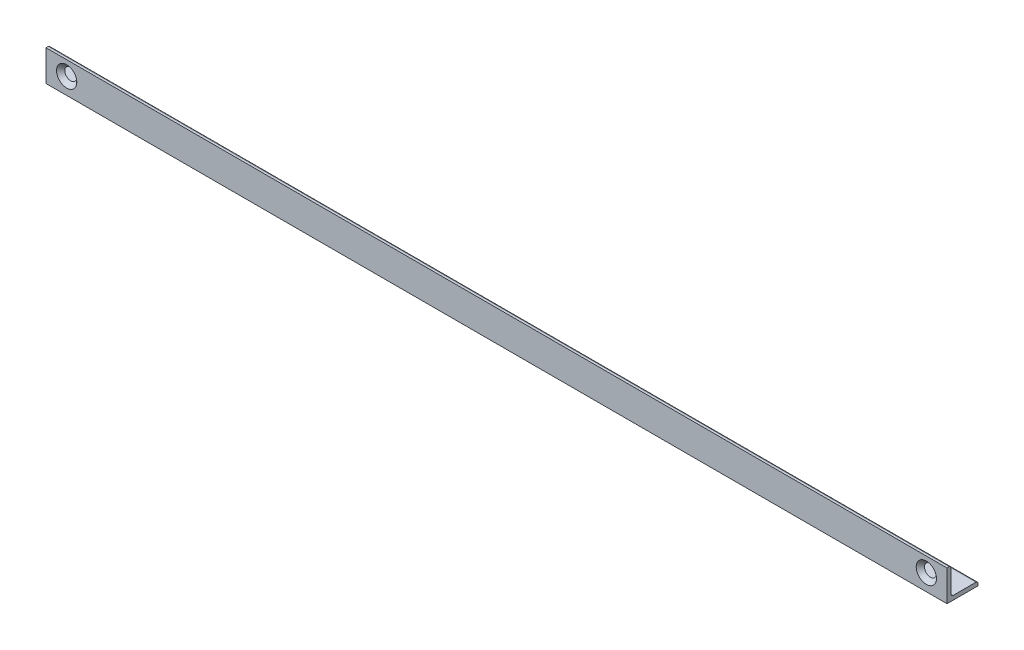
from build123d import *

# Parameters (mm, degrees)
EXTRUDE_1_DEPTH     = 436
SKETCH_4_R          = 2.75
CUT_EXTRUDE_3_DEPTH = 2
SKETCH_9_R          = 2.8
CUT_EXTRUDE_8_DEPTH = 437.515750002
CHAMFER_4_SIZE      = 2.098


with BuildPart() as part:
    # Эскиз1 → Бобышка-Вытянуть1 (new body)
    with BuildSketch(Plane(origin=(0, 0, 0), x_dir=(0, 0, -1), z_dir=(1, 0, 0))):
        with BuildLine():
            Line((0, 0), (0, 15))
            Line((0, 15), (1, 15))
            ThreePointArc((1, 15), (1.707106781, 14.707106781), (2, 14))
            Line((2, 14), (2, 3))
            ThreePointArc((2, 3), (2.292893219, 2.292893219), (3, 2))
            Line((3, 2), (14, 2))
            ThreePointArc((14, 2), (14.707106781, 1.707106781), (15, 1))
            Line((15, 1), (15, 0))
            Line((15, 0), (0, 0))
        make_face()
    extrude(amount=EXTRUDE_1_DEPTH)

    # Эскиз4 → Вырез-Вытянуть3 (cut)
    with BuildSketch(Plane.XZ):
        with Locations(Location((372, -9, 0), (0, 0, 270))):
            Circle(SKETCH_4_R)
        with Locations(Location((90, -9, 0), (0, 0, 270))):
            Circle(SKETCH_4_R)
    extrude(amount=-CUT_EXTRUDE_3_DEPTH, mode=Mode.SUBTRACT)

    # Эскиз9 → Вырез-Вытянуть8 (cut, through all)
    with BuildSketch(Plane.XY):
        with Locations((426, 8)):
            Circle(SKETCH_9_R)
        with Locations((10, 8)):
            Circle(SKETCH_9_R)
    extrude(amount=-CUT_EXTRUDE_8_DEPTH, mode=Mode.SUBTRACT)

    # Фаска4
    # the kernel refuses this chamfer: 2.098 mm, written as the material it takes off along each edge
    with BuildSketch(Plane(origin=(10, 8, 0), x_dir=(1, 0, 0), z_dir=(0, -1, 0))) as chamfer_4_piece_1:
        Polygon((2.8 + CHAMFER_4_SIZE, 0), (2.8, -CHAMFER_4_SIZE), (2.8, 0), align=None)
    revolve(axis=Axis((10, 8, 0), (0, 0, 1)), mode=Mode.SUBTRACT)
    with BuildSketch(Plane(origin=(426, 8, 0), x_dir=(1, 0, 0), z_dir=(0, -1, 0))) as chamfer_4_piece_2:
        Polygon((2.8 + CHAMFER_4_SIZE, 0), (2.8, -CHAMFER_4_SIZE), (2.8, 0), align=None)
    revolve(axis=Axis((426, 8, 0), (0, 0, 1)), mode=Mode.SUBTRACT)


solid = part.part
